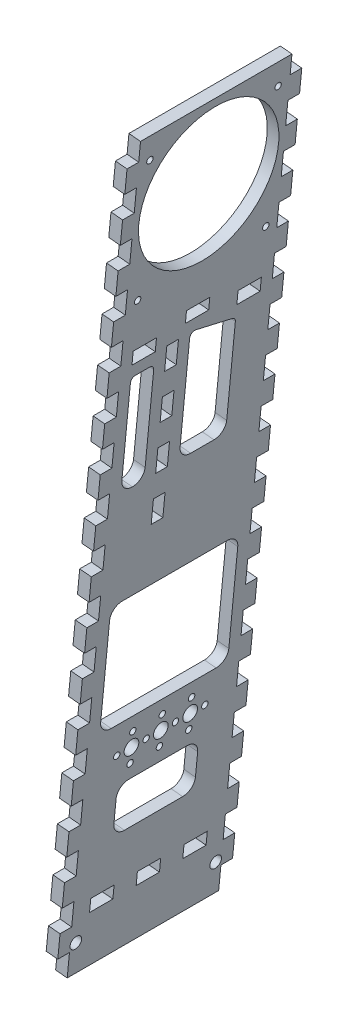
from build123d import *

# Parameters (mm, degrees)
BOSS_EXTRUDE1_DEPTH = 95.25
SKETCH3_RX          = 38.497574092
SKETCH3_RY          = 38.1
CUT_EXTRUDE1_DEPTH  = 433.314671688
SKETCH4_R           = 3.175
CUT_EXTRUDE2_DEPTH  = 433.314671721
SKETCH5_R           = 4
SKETCH5_R_2         = 1.75
CUT_EXTRUDE3_DEPTH  = 433.314671721
LPATTERN1_COUNT     = 3
LPATTERN1_PITCH     = 16
SKETCH6_W           = 69.85
SKETCH6_H           = 63.5
CUT_EXTRUDE4_DEPTH  = 433.314671721
SKETCH7_W           = 44.45
SKETCH7_H           = 25.4
CUT_EXTRUDE5_DEPTH  = 433.314671721
SKETCH8_W           = 6.35
SKETCH8_H           = 12.7
CUT_EXTRUDE6_DEPTH  = 433.314671721
LPATTERN2_COUNT     = 17
LPATTERN2_PITCH     = 25.4
SKETCH9_W           = 12.7
SKETCH9_H           = 6.990804807
CUT_EXTRUDE7_DEPTH  = 433.314671721
SKETCH10_R          = 1.75
CUT_EXTRUDE8_DEPTH  = 433.314671721
SKETCH11_W          = 6.35
SKETCH11_H          = 12.7
CUT_EXTRUDE9_DEPTH  = 433.314671721
LPATTERN3_COUNT     = 4
LPATTERN3_PITCH     = 25.4
SKETCH12_W          = 12.7
SKETCH12_H          = 6.35
CUT_EXTRUDE10_DEPTH = 433.314671721
SKETCH13_W          = 12.7
SKETCH13_H          = 6.990804807
CUT_EXTRUDE11_DEPTH = 433.314671721
SKETCH14_W          = 12.7
SKETCH14_H          = 57.619909617
CUT_EXTRUDE12_DEPTH = 433.314671721
FILLET1_R           = 6.35
FILLET2_R           = 6.35
FILLET3_R           = 2.54


with BuildPart() as part:
    # Sketch2 → Boss-Extrude1 (new body)
    with BuildSketch(Plane.XY):
        Polygon((6.730990299, 3.651723171), (0.41022444, 4.2603437), (40.3547401, 419.1), (46.675505959, 418.491379471), align=None)
    extrude(amount=BOSS_EXTRUDE1_DEPTH)

    # Sketch3 → Cut-Extrude1 (cut, through all)
    with BuildSketch(Plane(origin=(0, 0, 0), x_dir=(0, 0, 1), z_dir=(-0.9953961983671784, 0.09584575252022778, 0))):
        with Locations(Location((47.625, 378.198992034), (0, 0, 90))):
            Ellipse(SKETCH3_RX, SKETCH3_RY)
    extrude(amount=-CUT_EXTRUDE1_DEPTH, mode=Mode.SUBTRACT)

    # Sketch4 → Cut-Extrude2 (cut, through all)
    with BuildSketch(Plane(origin=(0, 0, 0), x_dir=(0, 0, 1), z_dir=(-0.9953961983671784, 0.09584575252022778, 0))):
        with Locations(Location((9.525, 20.155048192, 0), (0, 0, 270))):
            Circle(SKETCH4_R)
        with Locations(Location((85.725, 20.155048192, 0), (0, 0, 270))):
            Circle(SKETCH4_R)
    extrude(amount=-CUT_EXTRUDE2_DEPTH, mode=Mode.SUBTRACT)

    # Sketch5 → Cut-Extrude3 (cut, through all)
    with BuildSketch(Plane(origin=(0, 0, 0), x_dir=(0, 0, 1), z_dir=(-0.9953961983671784, 0.09584575252022781, 0))):
        with Locations(Location((63.625, 105.880048192, 0), (0, 0, 270))):
            Circle(SKETCH5_R)
        with Locations(Location((63.625, 113.880048192, 0), (0, 0, 270))):
            Circle(SKETCH5_R_2)
        with Locations(Location((71.625, 105.880048192, 0), (0, 0, 270))):
            Circle(SKETCH5_R_2)
        with Locations(Location((63.625, 97.880048192, 0), (0, 0, 270))):
            Circle(SKETCH5_R_2)
        with Locations(Location((55.625, 105.880048192, 0), (0, 0, 270))):
            Circle(SKETCH5_R_2)
    cut_extrude3 = extrude(amount=-CUT_EXTRUDE3_DEPTH, mode=Mode.SUBTRACT)

    # LPattern1: Cut-Extrude3 ×3
    with Locations(*[(0, 0, -i * LPATTERN1_PITCH) for i in range(1, LPATTERN1_COUNT)]):
        add(cut_extrude3, mode=Mode.SUBTRACT)

    # Sketch6 → Cut-Extrude4 (cut, through all)
    with BuildSketch(Plane(origin=(0, 0, 0), x_dir=(0, 0, 1), z_dir=(-0.9953961983671784, 0.09584575252022781, 0))):
        with Locations((47.625, 153.630048192)):
            Rectangle(SKETCH6_W, SKETCH6_H)
    extrude(amount=-CUT_EXTRUDE4_DEPTH, mode=Mode.SUBTRACT)

    # Sketch7 → Cut-Extrude5 (cut, through all)
    with BuildSketch(Plane(origin=(0, 0, 0), x_dir=(0, 0, 1), z_dir=(-0.9953961983671784, 0.09584575252022781, 0))):
        with Locations((47.625, 77.180048192)):
            Rectangle(SKETCH7_W, SKETCH7_H)
    extrude(amount=-CUT_EXTRUDE5_DEPTH, mode=Mode.SUBTRACT)

    # Sketch8 → Cut-Extrude6 (cut, through all)
    with BuildSketch(Plane(origin=(0, 0, 0), x_dir=(0, 0, 1), z_dir=(-0.9953961983671784, 0.09584575252022781, 0))):
        with Locations((3.175, 10.630048192)):
            Rectangle(SKETCH8_W, SKETCH8_H)
        with Locations((92.075, 10.630048192)):
            Rectangle(SKETCH8_W, SKETCH8_H)
    cut_extrude6 = extrude(amount=-CUT_EXTRUDE6_DEPTH, mode=Mode.SUBTRACT)

    # LPattern2: Cut-Extrude6 ×17
    with Locations(*[Vector(0.0958457525202278, 0.9953961983671784, 0) * (i * LPATTERN2_PITCH) for i in range(1, LPATTERN2_COUNT)]):
        add(cut_extrude6, mode=Mode.SUBTRACT)

    # Sketch9 → Cut-Extrude7 (cut, through all)
    with BuildSketch(Plane(origin=(0, 0, 0), x_dir=(0, 0, 1), z_dir=(-0.9953961983671784, 0.09584575252022781, 0))):
        with Locations((22.225, 35.392249159)):
            Rectangle(SKETCH9_W, SKETCH9_H)
        with Locations((47.625, 35.392249159)):
            Rectangle(SKETCH9_W, SKETCH9_H)
        with Locations((73.025, 35.392249159)):
            Rectangle(SKETCH9_W, SKETCH9_H)
    extrude(amount=-CUT_EXTRUDE7_DEPTH, mode=Mode.SUBTRACT)

    # Sketch10 → Cut-Extrude8 (cut, through all)
    with BuildSketch(Plane(origin=(0, 0, 0), x_dir=(0, 0, 1), z_dir=(-0.9953961983671784, 0.09584575252022781, 0))):
        with Locations(Location((12.7, 408.338377168, 0), (0, 0, 270))):
            Circle(SKETCH10_R)
        with Locations(Location((82.55, 408.338377168, 0), (0, 0, 270))):
            Circle(SKETCH10_R)
        with Locations(Location((82.55, 338.488377168, 0), (0, 0, 270))):
            Circle(SKETCH10_R)
        with Locations(Location((12.7, 338.488377168, 0), (0, 0, 270))):
            Circle(SKETCH10_R)
    extrude(amount=-CUT_EXTRUDE8_DEPTH, mode=Mode.SUBTRACT)

    # Sketch11 → Cut-Extrude9 (cut, through all)
    with BuildSketch(Plane(origin=(0, 0, 0), x_dir=(0, 0, 1), z_dir=(-0.9953961983671784, 0.09584575252022781, 0))):
        with Locations((60.325, 223.189819233)):
            Rectangle(SKETCH11_W, SKETCH11_H)
    cut_extrude9 = extrude(amount=-CUT_EXTRUDE9_DEPTH, mode=Mode.SUBTRACT)

    # LPattern3: Cut-Extrude9 ×4
    with Locations(*[Vector(0.09584575252022781, 0.9953961983671784, 0) * (i * LPATTERN3_PITCH) for i in range(1, LPATTERN3_COUNT)]):
        add(cut_extrude9, mode=Mode.SUBTRACT)

    # Sketch12 → Cut-Extrude10 (cut, through all)
    with BuildSketch(Plane(origin=(0, 0, 0), x_dir=(0, 0, 1), z_dir=(-0.9953961983671784, 0.09584575252022781, 0))):
        with Locations((47.625, 315.118627414)):
            Rectangle(SKETCH12_W, SKETCH12_H)
    extrude(amount=-CUT_EXTRUDE10_DEPTH, mode=Mode.SUBTRACT)

    # Sketch13 → Cut-Extrude11 (cut, through all)
    with BuildSketch(Plane(origin=(0, 0, 0), x_dir=(0, 0, 1), z_dir=(-0.9953961983671784, 0.09584575252022781, 0))):
        with Locations((19.05, 309.705131253)):
            Rectangle(SKETCH13_W, SKETCH13_H)
        with Locations((76.2, 309.705131253)):
            Rectangle(SKETCH13_W, SKETCH13_H)
    extrude(amount=-CUT_EXTRUDE11_DEPTH, mode=Mode.SUBTRACT)

    # Sketch14 → Cut-Extrude12 (cut, through all)
    with BuildSketch(Plane(origin=(0, 0, 0), x_dir=(0, 0, 1), z_dir=(-0.9953961983671784, 0.09584575252022783, 0))):
        with Locations((76.2, 271.049774042)):
            Rectangle(SKETCH14_W, SKETCH14_H)
        Polygon((50.8, 242.239819233), (25.4, 242.239819233), (25.4, 299.85972885), (50.8, 306.20972885), (50.8, 299.85972885), align=None)
    extrude(amount=-CUT_EXTRUDE12_DEPTH, mode=Mode.SUBTRACT)

    # Fillet1
    fillet1_edges = [part.edges().sort_by_distance(p)[0] for p in [
        (9.340521671, 63.878884577, 25.4),
        (11.775003785, 89.161948016, 25.4),
        (11.775003785, 89.161948016, 69.85),
        (9.340521671, 63.878884577, 69.85),
        (14.842067866, 121.014626363, 12.7),
        (20.928273151, 184.22228496, 12.7),
        (20.928273151, 184.22228496, 82.55),
        (14.842067866, 121.014626363, 82.55),
    ]]
    fillet(fillet1_edges, radius=FILLET1_R)

    # Fillet2
    fillet2_edges = [part.edges().sort_by_distance(p)[0] for p in [
        (26.378040695, 240.820284894, 69.85),
        (26.378040695, 240.820284894, 82.55),
        (26.378040695, 240.820284894, 50.8),
        (26.378040695, 240.820284894, 25.4),
    ]]
    fillet(fillet2_edges, radius=FILLET2_R - 0.0001)  # a hair under: the kernel refuses the full size

    # Fillet3
    fillet3_edges = [part.edges().sort_by_distance(p)[0] for p in [
        (31.900664292, 298.174923876, 69.85),
        (31.900664292, 298.174923876, 82.55),
        (31.900664292, 298.174923876, 25.4),
        (32.50928482, 304.495689736, 50.8),
    ]]
    fillet(fillet3_edges, radius=FILLET3_R)


solid = part.part
